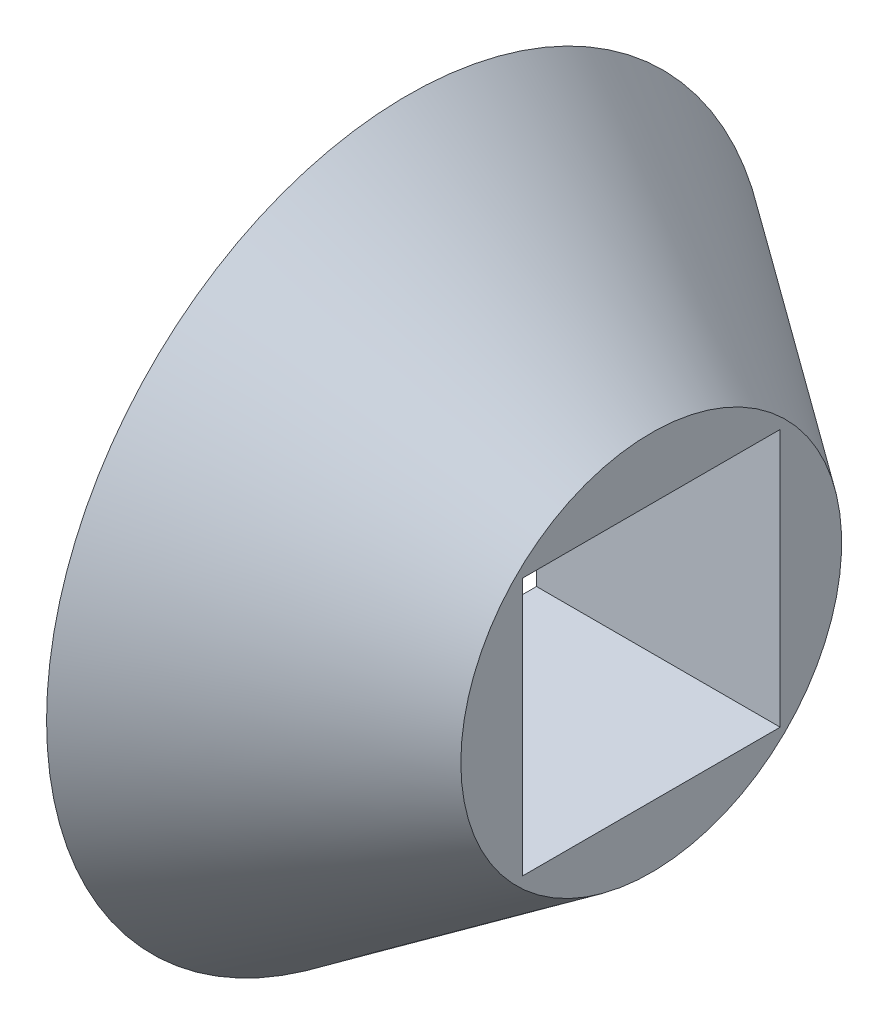
from build123d import *

# Parameters (mm, degrees)
SKETCH1_R           = 4.445
SKETCH1_W           = 3.175
SKETCH1_H           = 3.175
BOSS_EXTRUDE1_DEPTH = 3


with BuildPart() as part:
    # Sketch1 → Boss-Extrude1 (new body)
    with BuildSketch(Plane(origin=(0, 0, 0), x_dir=(0, 0, -1), z_dir=(1, 0, 0))):
        Circle(SKETCH1_R)
        Rectangle(SKETCH1_W, SKETCH1_H, mode=Mode.SUBTRACT)
    extrude(amount=BOSS_EXTRUDE1_DEPTH)

    # Sketch2 → Cut-Revolve1 (revolve, cut)
    with BuildSketch(Plane.XY):
        Polygon((0, 4.445), (3, 4.445), (3, 2.344377385), align=None)
    revolve(axis=Axis((0, 0, 0), (1, 0, 0)), mode=Mode.SUBTRACT)


solid = part.part
